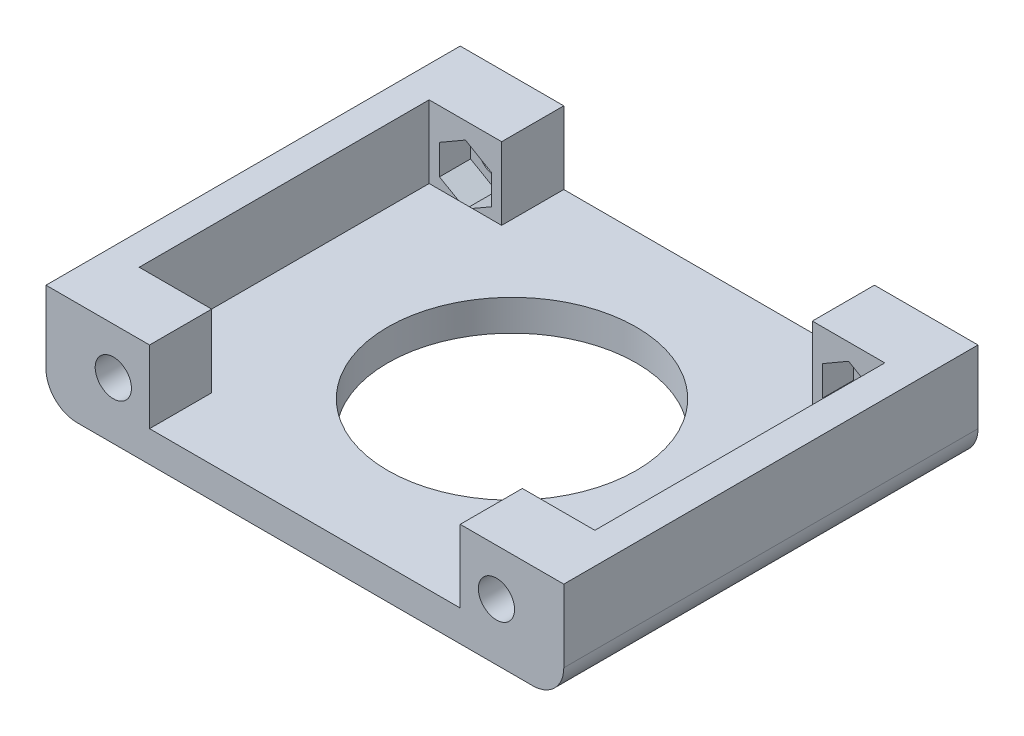
from build123d import *

# Parameters (mm, degrees)
SKETCH1_W            = 50
SKETCH1_H            = 40
BOSS_EXTRUDE1_DEPTH  = 3
SKETCH2_R            = 12
CUT_EXTRUDE1_DEPTH   = 33.155870382
SKETCH3_W            = 3
SKETCH3_H            = 40
BOSS_EXTRUDE2_DEPTH  = 7
SKETCH4_W            = 7
SKETCH4_H            = 7
BOSS_EXTRUDE3_DEPTH  = 6
SKETCH5_R            = 1.75
CUT_EXTRUDE2_DEPTH   = 49.218253805
CUT_EXTRUDE3_DEPTH   = 3
MIRROR3_COPY_1_DEPTH = 3
MIRROR3_COPY_2_DEPTH = 3
FILLET1_R            = 3


with BuildPart() as part:
    # Sketch1 → Boss-Extrude1 (new body)
    with BuildSketch(Plane(origin=(0, 0, 0), x_dir=(1, 0, 0), z_dir=(0, 1, 0))):
        Rectangle(SKETCH1_W, SKETCH1_H)
    extrude(amount=BOSS_EXTRUDE1_DEPTH)

    # Sketch2 → Cut-Extrude1 (cut, through all)
    with BuildSketch(Plane(origin=(0, 3, 0), x_dir=(1, 0, 0), z_dir=(0, 1, 0))):
        Circle(SKETCH2_R)
    extrude(amount=-CUT_EXTRUDE1_DEPTH, mode=Mode.SUBTRACT)

    # Sketch3 → Boss-Extrude2 (add)
    with BuildSketch(Plane(origin=(0, 3, 0), x_dir=(1, 0, 0), z_dir=(0, 1, 0))):
        with Locations((-23.5, 0)):
            Rectangle(SKETCH3_W, SKETCH3_H)
        with Locations((23.5, 0)):
            Rectangle(SKETCH3_W, SKETCH3_H)
    extrude(amount=BOSS_EXTRUDE2_DEPTH)

    # Sketch4 → Boss-Extrude3 (add)
    with BuildSketch(Plane.XY.offset(20)):
        with Locations((-18.5, 6.5)):
            Rectangle(SKETCH4_W, SKETCH4_H)
        with Locations((18.5, 6.5)):
            Rectangle(SKETCH4_W, SKETCH4_H)
    boss_extrude3 = extrude(amount=-BOSS_EXTRUDE3_DEPTH)

    # Sketch5 → Cut-Extrude2 (cut, through all)
    with BuildSketch(Plane.XY.offset(20)):
        with Locations((-18.5, 5.5)):
            Circle(SKETCH5_R)
        with Locations((18.5, 5.5)):
            Circle(SKETCH5_R)
    cut_extrude2 = extrude(amount=-CUT_EXTRUDE2_DEPTH, mode=Mode.SUBTRACT)

    # Mirror1: Boss-Extrude3, Cut-Extrude2 across plane
    add(boss_extrude3.mirror(Plane.XY))
    add(cut_extrude2.mirror(Plane.XY), mode=Mode.SUBTRACT)

    # Sketch6 → Cut-Extrude3 (cut)
    with BuildSketch(Plane.XY.offset(-14)):
        Polygon((-18.5, 2.613248654), (-16, 4.056624327), (-16, 6.943375673), (-18.5, 8.386751346), (-21, 6.943375673), (-21, 4.056624327), align=None)
    cut_extrude3 = extrude(amount=-CUT_EXTRUDE3_DEPTH, mode=Mode.SUBTRACT)

    # Mirror2: Cut-Extrude3 across plane
    add(cut_extrude3.mirror(Plane(origin=(0, 0, 0), x_dir=(0, 0, 1), z_dir=(1, 0, 0))), mode=Mode.SUBTRACT)

    # Mirror3 copy 1 sketch → Mirror3 copy 1 (cut)
    with BuildSketch(Plane(origin=(0, 0, 14), x_dir=(-1, 0, 0), z_dir=(0, 0, -1))):
        Polygon((-18.5, 2.613248654), (-16, 4.056624327), (-16, 6.943375673), (-18.5, 8.386751346), (-21, 6.943375673), (-21, 4.056624327), align=None)
    extrude(amount=-MIRROR3_COPY_1_DEPTH, mode=Mode.SUBTRACT)

    # Mirror3 copy 2 sketch → Mirror3 copy 2 (cut)
    with BuildSketch(Plane(origin=(0, 0, 14), x_dir=(1, 0, 0), z_dir=(0, 0, -1))):
        Polygon((-18.5, -2.613248654), (-16, -4.056624327), (-16, -6.943375673), (-18.5, -8.386751346), (-21, -6.943375673), (-21, -4.056624327), align=None)
    extrude(amount=-MIRROR3_COPY_2_DEPTH, mode=Mode.SUBTRACT)

    # Fillet1
    fillet1_edges = [part.edges().sort_by_distance(p)[0] for p in [
        (-25, 0, 0),
        (25, 0, 0),
    ]]
    fillet(fillet1_edges, radius=FILLET1_R)


solid = part.part
